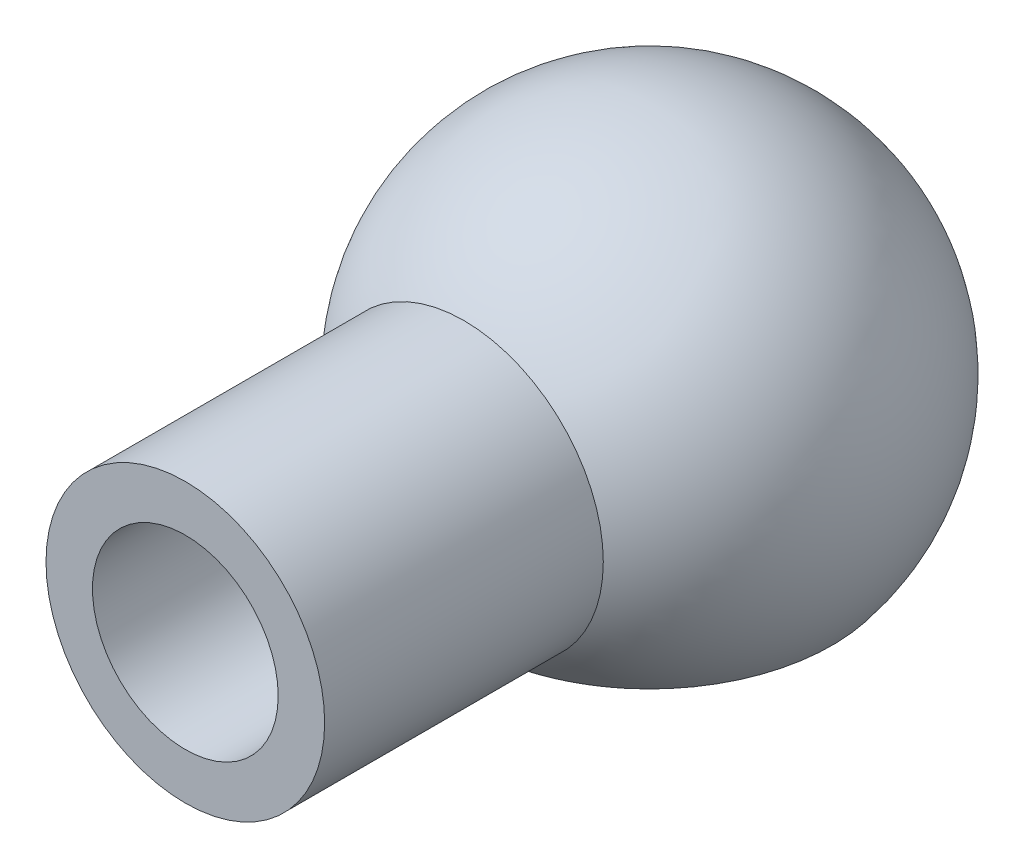
from build123d import *

# Parameters (mm, degrees)
SKETCH_1_R          = 6
SKETCH_1_R_2        = 4
EXTRUDE_1_DEPTH     = 20
CUT_EXTRUDE_START   = -12
SKETCH_3_R          = 4
CUT_EXTRUDE_2_DEPTH = 12


with BuildPart() as part:
    # 草图1 → 凸台-拉伸1 (new body)
    with BuildSketch(Plane.XY):
        Circle(SKETCH_1_R)
        Circle(SKETCH_1_R_2, mode=Mode.SUBTRACT)
    extrude(amount=EXTRUDE_1_DEPTH)

    # 草图2 → 旋转3 (revolve)
    with BuildSketch(Plane(origin=(0, 0, 0), x_dir=(1, 0, 0), z_dir=(0, 1, 0))):
        with BuildLine():
            Line((0, 10), (0, -10))
            ThreePointArc((0, -10), (-10, 0), (0, 10))
        make_face()
    revolve(axis=Axis((0, 0, 0), (0, 0, -1)))

    # 草图3 → 切除-拉伸2 (cut)
    with BuildSketch(Plane.XY.offset(20).offset(CUT_EXTRUDE_START)):
        Circle(SKETCH_3_R)
    extrude(amount=CUT_EXTRUDE_2_DEPTH, mode=Mode.SUBTRACT)

    # 草图4 → 切除-旋转1 (revolve, cut)
    with BuildSketch(Plane(origin=(0, 0, 0), x_dir=(0, 0, -1), z_dir=(1, 0, 0))):
        with BuildLine():
            Line((0, 7), (0, -7))
            Line((0, -7), (0, -10))
            Line((0, -10), (6, -10))
            Line((6, -10), (7.857142857, -6.185895741))
            Line((7.857142857, -6.185895741), (5.5, -4.330127019))
            ThreePointArc((5.5, -4.330127019), (6.297256908, 3.056886559), (0, 7))
        make_face()
    revolve(axis=Axis((0, 0, 0), (0, 1, 0)), mode=Mode.SUBTRACT)


with BuildPart() as cut_revolve_1_kept_piece:
    # of the separate pieces the step leaves, the one the design keeps (cut_revolve_1_pieces_kept)
    add(part.part.solids().sort_by_distance((-6, 0, 8))[0])


solid = cut_revolve_1_kept_piece.part
